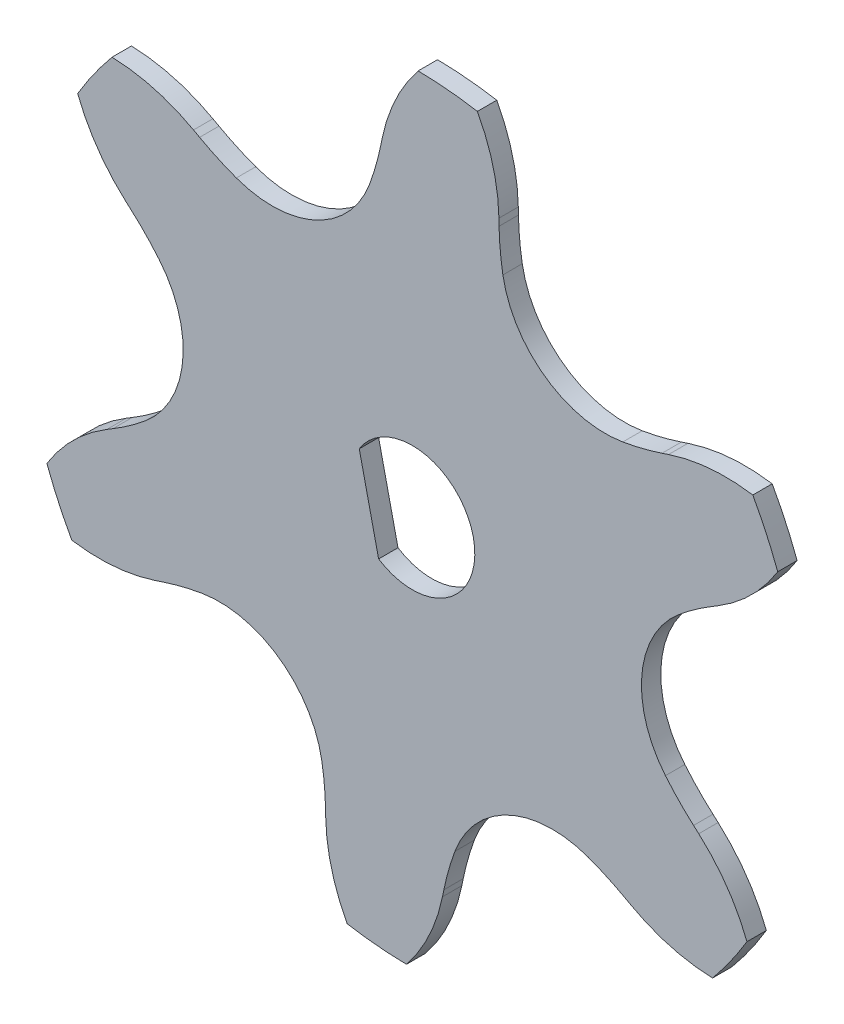
from build123d import *

# Parameters (mm, degrees)
SKETCH1_R               = 34.867744869
BASE_FLANGE1_DEPTH      = 0.7366
CUT_EXTRUDE1_DEPTH      = 166.090690723
CUT_EXTRUDE1_DEPTH_BACK = 166.090690723
SKETCH2_R               = 180.553154812
CUT_EXTRUDE2_DEPTH      = 143.907778027
CUT_EXTRUDE2_DEPTH_BACK = 143.907778027


# Sheet-metal steps are written as plain solids
with BuildPart() as part:
    # Sketch1 → Base-Flange1 (new body)
    with BuildSketch(Plane.XY):
        Circle(SKETCH1_R)
    extrude(amount=-BASE_FLANGE1_DEPTH)

    # Sketch2 → Cut-Extrude1 (cut, two sides: drawn at the far end of the back side and taken through both)
    with BuildSketch(Plane(origin=(-59.555266985, -54.618905297, 100.906749206), x_dir=(-1, 0, 0), z_dir=(0, 0, -1)).offset(-CUT_EXTRUDE1_DEPTH_BACK)):
        with Locations((-70.46331512, 53.044531114)):
            Circle(SKETCH2_R)
        with BuildLine():
            Line((-81.344420416, 48.08529911), (-81.147360116, 48.260073924))
            ThreePointArc((-81.147360116, 48.260073924), (-80.592208079, 48.791271643), (-80.078779721, 49.362897501))
            ThreePointArc((-80.078779721, 49.362897501), (-79.183035074, 52.245324657), (-80.587831747, 54.91689556))
            ThreePointArc((-80.587831747, 54.91689556), (-81.196617582, 55.385664809), (-81.839082773, 55.807094848))
            Line((-81.839082773, 55.807094848), (-82.06463088, 55.943135463))
            ThreePointArc((-82.06463088, 55.943135463), (-83.339743584, 56.936582022), (-84.344361609, 58.202911795))
            ThreePointArc((-84.344361609, 58.202911795), (-83.910146998, 59.247357512), (-83.397480034, 60.255614309))
            ThreePointArc((-83.397480034, 60.255614309), (-81.782081355, 60.31336879), (-80.198688666, 59.98822872))
            Line((-80.198688666, 59.98822872), (-79.948799088, 59.904956901))
            ThreePointArc((-79.948799088, 59.904956901), (-79.21119235, 59.689779993), (-78.459435657, 59.530950921))
            ThreePointArc((-78.459435657, 59.530950921), (-75.515308192, 60.196426879), (-73.904058259, 62.748801937))
            ThreePointArc((-73.904058259, 62.748801937), (-73.802485098, 63.51041056), (-73.758748573, 64.277516756))
            Line((-73.758748573, 64.277516756), (-73.753707998, 64.540867454))
            ThreePointArc((-73.753707998, 64.540867454), (-73.530914393, 66.141870727), (-72.936549652, 67.645060345))
            ThreePointArc((-72.936549652, 67.645060345), (-71.814925823, 67.79124232), (-70.685416342, 67.851388104))
            ThreePointArc((-70.685416342, 67.851388104), (-69.827700155, 66.481289051), (-69.317583371, 64.947460723))
            Line((-69.317583371, 64.947460723), (-69.264754091, 64.689414091))
            ThreePointArc((-69.264754091, 64.689414091), (-69.082299391, 63.943039464), (-68.843971056, 63.212584534))
            ThreePointArc((-68.843971056, 63.212584534), (-66.795588238, 60.995633336), (-63.779541631, 60.876437491))
            ThreePointArc((-63.779541631, 60.876437491), (-63.069182636, 61.169276865), (-62.38298092, 61.514953022))
            Line((-62.38298092, 61.514953022), (-62.152392238, 61.642263104))
            ThreePointArc((-62.152392238, 61.642263104), (-60.654485929, 62.249819819), (-59.055503163, 62.486679664))
            ThreePointArc((-59.055503163, 62.486679664), (-58.368093945, 61.588415921), (-57.751251427, 60.640304909))
            ThreePointArc((-57.751251427, 60.640304909), (-58.508933919, 59.212451375), (-59.582209824, 58.003763118))
            Line((-59.582209824, 58.003763118), (-59.779270124, 57.828988304))
            ThreePointArc((-59.779270124, 57.828988304), (-60.334422161, 57.297790585), (-60.847850519, 56.726164727))
            ThreePointArc((-60.847850519, 56.726164727), (-61.743595166, 53.843737571), (-60.338798493, 51.172166668))
            ThreePointArc((-60.338798493, 51.172166668), (-59.730012659, 50.703397419), (-59.087547467, 50.28196738))
            Line((-59.087547467, 50.28196738), (-58.861999361, 50.145926765))
            ThreePointArc((-58.861999361, 50.145926765), (-57.586886657, 49.152480206), (-56.582268631, 47.886150433))
            ThreePointArc((-56.582268631, 47.886150433), (-57.016483242, 46.841704716), (-57.529150206, 45.833447919))
            ThreePointArc((-57.529150206, 45.833447919), (-59.144548885, 45.775693438), (-60.727941574, 46.100833508))
            Line((-60.727941574, 46.100833508), (-60.977831152, 46.184105327))
            ThreePointArc((-60.977831152, 46.184105327), (-61.71543789, 46.399282235), (-62.467194583, 46.558111307))
            ThreePointArc((-62.467194583, 46.558111307), (-65.411322049, 45.892635349), (-67.022571982, 43.340260291))
            ThreePointArc((-67.022571982, 43.340260291), (-67.124145142, 42.578651669), (-67.167881667, 41.811545472))
            Line((-67.167881667, 41.811545472), (-67.172922242, 41.548194774))
            ThreePointArc((-67.172922242, 41.548194774), (-67.395715847, 39.947191501), (-67.990080588, 38.444001883))
            ThreePointArc((-67.990080588, 38.444001883), (-69.111704417, 38.297819908), (-70.241213899, 38.237674124))
            ThreePointArc((-70.241213899, 38.237674124), (-71.098930085, 39.607773177), (-71.60904687, 41.141601505))
            Line((-71.60904687, 41.141601505), (-71.661876149, 41.399648137))
            ThreePointArc((-71.661876149, 41.399648137), (-71.844330849, 42.146022764), (-72.082659185, 42.876477694))
            ThreePointArc((-72.082659185, 42.876477694), (-74.131042002, 45.093428892), (-77.147088609, 45.212624737))
            ThreePointArc((-77.147088609, 45.212624737), (-77.857447604, 44.919785363), (-78.54364932, 44.574109206))
            Line((-78.54364932, 44.574109206), (-78.774238002, 44.446799124))
            ThreePointArc((-78.774238002, 44.446799124), (-80.272144311, 43.839242409), (-81.871127077, 43.602382564))
            ThreePointArc((-81.871127077, 43.602382564), (-82.558536295, 44.500646307), (-83.175378813, 45.448757319))
            ThreePointArc((-83.175378813, 45.448757319), (-82.417696321, 46.876610853), (-81.344420416, 48.08529911))
        make_face(mode=Mode.SUBTRACT)
    extrude(amount=CUT_EXTRUDE1_DEPTH + CUT_EXTRUDE1_DEPTH_BACK, mode=Mode.SUBTRACT)

    # Sketch3 → Cut-Extrude2 (cut, two sides: drawn at the far end of the back side and taken through both)
    with BuildSketch(Plane(origin=(-59.555266985, -54.618905297, 92.56319002), x_dir=(-1, 0, 0), z_dir=(0, 0, -1)).offset(-CUT_EXTRUDE2_DEPTH_BACK)):
        with BuildLine():
            Line((-69.183385772, 51.044048454), (-68.447999148, 54.300975121))
            ThreePointArc((-68.447999148, 54.300975121), (-72.779897357, 53.567595882), (-69.183385772, 51.044048454))
        make_face()
    extrude(amount=CUT_EXTRUDE2_DEPTH + CUT_EXTRUDE2_DEPTH_BACK, mode=Mode.SUBTRACT)


solid = part.part
